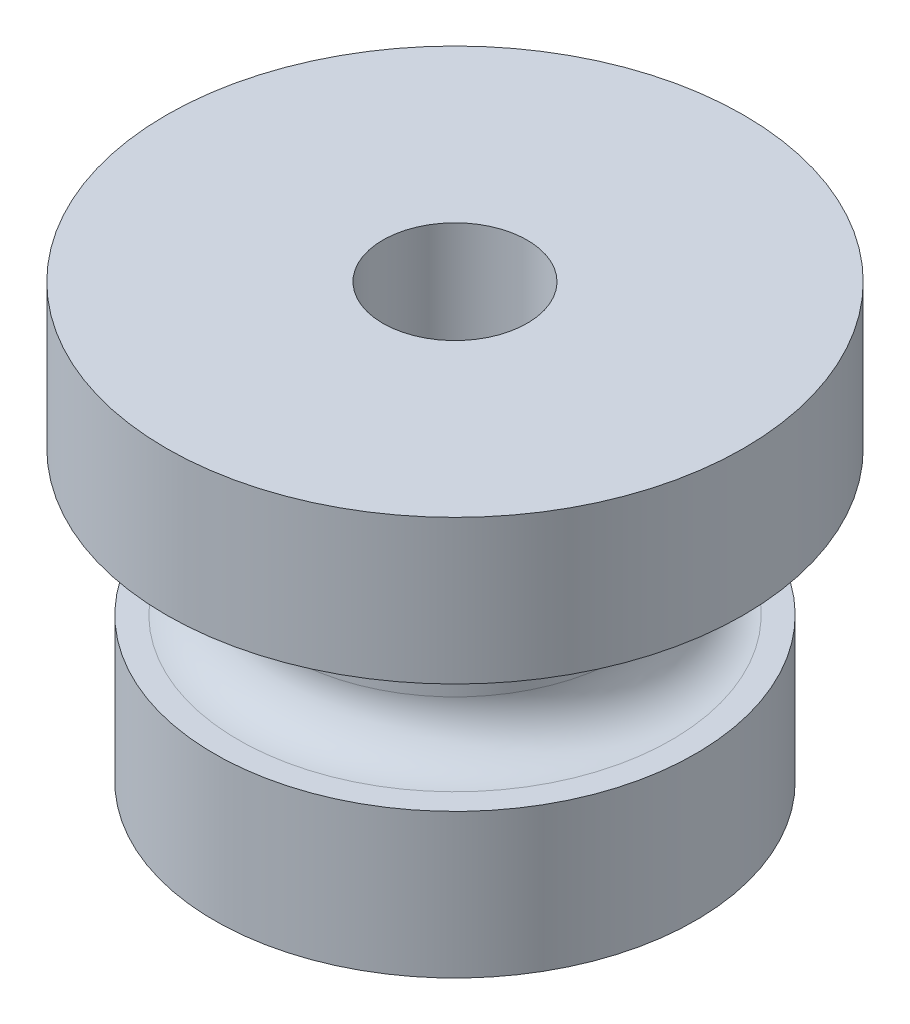
from build123d import *

# Parameters (mm, degrees)
SKETCH1_R           = 3.5
SKETCH1_R_2         = 1.5
BOSS_EXTRUDE1_DEPTH = 9
BOSS_EXTRUDE2_START = -3
SKETCH2_R           = 6
SKETCH2_R_2         = 1.5
BOSS_EXTRUDE2_DEPTH = 3
SKETCH3_R           = 5
SKETCH3_R_2         = 1.5
BOSS_EXTRUDE3_DEPTH = 3
FILLET2_R           = 1


with BuildPart() as part:
    # Sketch1 → Boss-Extrude1 (new body)
    with BuildSketch(Plane(origin=(0, 0, 0), x_dir=(1, 0, 0), z_dir=(0, 1, 0))):
        Circle(SKETCH1_R)
        Circle(SKETCH1_R_2, mode=Mode.SUBTRACT)
    extrude(amount=BOSS_EXTRUDE1_DEPTH)

    # Sketch2 → Boss-Extrude2 (add)
    with BuildSketch(Plane(origin=(0, 9, 0), x_dir=(1, 0, 0), z_dir=(0, 1, 0)).offset(BOSS_EXTRUDE2_START)):
        Circle(SKETCH2_R)
        Circle(SKETCH2_R_2, mode=Mode.SUBTRACT)
    extrude(amount=BOSS_EXTRUDE2_DEPTH)

    # Sketch3 → Boss-Extrude3 (add)
    with BuildSketch(Plane.XZ):
        Circle(SKETCH3_R)
        Circle(SKETCH3_R_2, mode=Mode.SUBTRACT)
    extrude(amount=-BOSS_EXTRUDE3_DEPTH)

    # Fillet2
    fillet2_edges = [part.edges().sort_by_distance(p)[0] for p in [
        (-3.5, 3, 0),
        (-3.5, 6, 0),
    ]]
    fillet(fillet2_edges, radius=FILLET2_R)


solid = part.part
